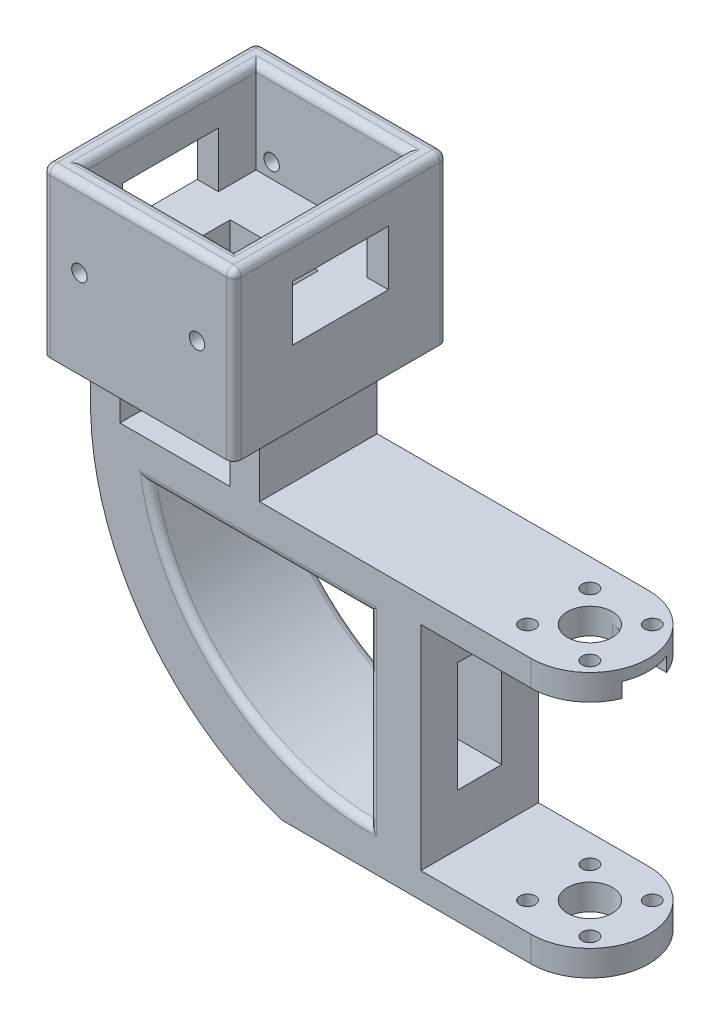
from build123d import *

# Parameters (mm, degrees)
SKETCH_1_R           = 3.05
SKETCH_1_R_2         = 1.05
EXTRUDE_1_DEPTH      = 3.5
SKETCH_2_W           = 16
SKETCH_2_H           = 36
EXTRUDE_2_DEPTH      = 3.5
SKETCH_4_W           = 16
SKETCH_4_H           = 36
EXTRUDE_3_DEPTH      = 41.43
CUT_EXTRUDE_1_DEPTH  = 2
SKETCH_6_W           = 23
SKETCH_6_H           = 16
EXTRUDE_4_DEPTH      = 19.21
EXTRUDE_7_DEPTH      = 12.5
EXTRUDE_7_DEPTH_BACK = 10
SKETCH_9_W           = 3.515
SKETCH_9_H           = 10
EXTRUDE_8_DEPTH      = 20
EXTRUDE_9_DEPTH      = 3
SKETCH_11_R          = 1.05
CUT_EXTRUDE_2_DEPTH  = 31.5
SKETCH_12_W          = 15
SKETCH_12_H          = 6.433017237
CUT_EXTRUDE_3_DEPTH  = 94.183551258
CUT_EXTRUDE_4_REACH  = 76.726
SKETCH_13_W          = 11.984921516
SKETCH_13_H          = 8
SKETCH_14_W          = 13.03
SKETCH_14_H          = 7.5
CUT_EXTRUDE_5_DEPTH  = 98.004196945
CUT_EXTRUDE_6_REACH  = 84.547
SKETCH_15_W          = 6
SKETCH_15_H          = 15
SKETCH_17_W          = 20
SKETCH_17_H          = 12.5
CUT_EXTRUDE_11_DEPTH = 11.625
CUT_EXTRUDE_12_DEPTH = 10.125
FILLET_2_R           = 1
FILLET_3_R           = 1
FILLET_5_R           = 1
FILLET_7_R           = 1


with BuildPart() as part:
    # 草图1 → 凸台-拉伸1 (new body)
    with BuildSketch(Plane(origin=(0, 0, 0), x_dir=(1, 0, 0), z_dir=(0, 1, 0))):
        with BuildLine():
            Line((0, 8), (-15, 8))
            Line((-15, 8), (-15, -8))
            Line((-15, -8), (0, -8))
            ThreePointArc((0, -8), (8, 0), (0, 8))
        make_face()
        with Locations(Location((0, 0, 0), (0, 0, 270))):
            Circle(SKETCH_1_R, mode=Mode.SUBTRACT)
        with Locations(Location((-4.242640687, 4.242640687, 0), (0, 0, 270))):
            Circle(SKETCH_1_R_2, mode=Mode.SUBTRACT)
        with Locations(Location((-4.242640687, -4.242640687, 0), (0, 0, 270))):
            Circle(SKETCH_1_R_2, mode=Mode.SUBTRACT)
        with Locations(Location((4.242640687, -4.242640687, 0), (0, 0, 90))):
            Circle(SKETCH_1_R_2, mode=Mode.SUBTRACT)
        with Locations(Location((4.242640687, 4.242640687, 0), (0, 0, 90))):
            Circle(SKETCH_1_R_2, mode=Mode.SUBTRACT)
    extrude(amount=EXTRUDE_1_DEPTH)


with BuildPart() as body_2:
    # 镜向4: mirrored copy
    add(part.part.mirror(Plane.ZX.offset(18)))


with BuildPart() as part_1:
    add(part.part)

    add(body_2.part)  # 凸台-拉伸2 merges body 2
    # 草图2 → 凸台-拉伸2 (add)
    with BuildSketch(Plane.ZY.offset(15)):
        with Locations((0, 18)):
            Rectangle(SKETCH_2_W, SKETCH_2_H)
    extrude(amount=EXTRUDE_2_DEPTH)

    # 草图4 → 凸台-拉伸3 (add)
    with BuildSketch(Plane.ZY.offset(18.5)):
        with Locations((0, 18)):
            Rectangle(SKETCH_4_W, SKETCH_4_H)
    extrude(amount=EXTRUDE_3_DEPTH)

    # 草图5 → 切除-拉伸1 (cut)
    with BuildSketch(Plane.XZ.offset(-32.5)):
        with BuildLine():
            Line((0, 3.05), (8.87097286, 3.05))
            Line((8.87097286, 3.05), (10.441846702, -3.05))
            Line((10.441846702, -3.05), (0, -3.05))
            ThreePointArc((0, -3.05), (3.05, 0), (0, 3.05))
        make_face()
    extrude(amount=-CUT_EXTRUDE_1_DEPTH, mode=Mode.SUBTRACT)

    # 草图6 → 凸台-拉伸4 (add)
    with BuildSketch(Plane(origin=(0, 36, 0), x_dir=(1, 0, 0), z_dir=(0, 1, 0))):
        with Locations((-48.43, 0)):
            Rectangle(SKETCH_6_W, SKETCH_6_H)
    extrude(amount=EXTRUDE_4_DEPTH)

    # 草图8 → 凸台-拉伸7 (add, two sides: drawn at the far end of the back side and taken through both)
    with BuildSketch(Plane(origin=(0, 55.21, 0), x_dir=(1, 0, 0), z_dir=(0, 1, 0)).offset(-EXTRUDE_7_DEPTH_BACK)):
        Polygon((-56.93, 11.515), (-36.93, 11.515), (-36.93, 14.515), (-59.93, 14.515), (-59.93, 11.515), (-59.93, 0), (-59.93, -11.515), (-59.93, -14.515), (-36.93, -14.515), (-36.93, -11.515), (-56.93, -11.515), (-56.93, -8), (-56.93, 8), align=None)
    extrude(amount=EXTRUDE_7_DEPTH + EXTRUDE_7_DEPTH_BACK)

    # 草图9 → 凸台-拉伸8 (add)
    with BuildSketch(Plane(origin=(-56.93, 0, 0), x_dir=(0, 0, -1), z_dir=(1, 0, 0))):
        with Locations((-9.7575, 50.21)):
            Rectangle(SKETCH_9_W, SKETCH_9_H)
        with Locations((9.7575, 50.21)):
            Rectangle(SKETCH_9_W, SKETCH_9_H)
    extrude(amount=EXTRUDE_8_DEPTH)

    # 草图10 → 凸台-拉伸9 (add)
    with BuildSketch(Plane(origin=(-36.93, 0, 0), x_dir=(0, 0, -1), z_dir=(1, 0, 0))):
        Polygon((-11.515, 67.71), (11.515, 67.71), (14.515, 67.71), (14.515, 45.21), (8, 45.21), (-8, 45.21), (-14.515, 45.21), (-14.515, 67.71), align=None)
    extrude(amount=EXTRUDE_9_DEPTH)

    # 草图11 → 切除-拉伸2 (cut, symmetric)
    with BuildSketch(Plane(origin=(0, 0, 11.515), x_dir=(-1, 0, 0), z_dir=(0, 0, -1))):
        with Locations((38.93, 57.21)):
            Circle(SKETCH_11_R)
        with Locations((54.93, 57.21)):
            Circle(SKETCH_11_R)
    extrude(amount=CUT_EXTRUDE_2_DEPTH, both=True, mode=Mode.SUBTRACT)

    # 草图12 → 切除-拉伸3 (cut, through all)
    with BuildSketch(Plane(origin=(0, 0, -8), x_dir=(-1, 0, 0), z_dir=(0, 0, -1))):
        with BuildLine():
            Line((22, 30.5), (22, 5.5))
            ThreePointArc((22, 5.5), (41.52562419, 12.569250972), (52, 30.5))
            Line((52, 30.5), (22, 30.5))
        make_face()
        with Locations((48.43, 38.993491382)):
            Rectangle(SKETCH_12_W, SKETCH_12_H)
        with BuildLine():
            Line((59.918359247, 35.060355361), (67.982296312, -21.171088437))
            Line((67.982296312, -21.171088437), (30.309681235, -1.008567897))
            ThreePointArc((30.309681235, -1.008567897), (51.317225959, 11.93373394), (59.918359247, 35.060355361))
        make_face()
    extrude(amount=-CUT_EXTRUDE_3_DEPTH, mode=Mode.SUBTRACT)

    # 草图13 → 切除-拉伸4 (cut, up to next)
    with BuildSketch(Plane.XZ.offset(-42.21), mode=Mode.PRIVATE) as cut_extrude_4_sk1:
        with Locations((-46.937539242, 0)):
            Rectangle(SKETCH_13_W, SKETCH_13_H)
    cut_extrude_4_tool1 = extrude(cut_extrude_4_sk1.sketch, amount=-CUT_EXTRUDE_4_REACH, mode=Mode.PRIVATE) & part_1.part
    add(cut_extrude_4_tool1.solids().sort_by_distance((-46.937539, 42.21, 0))[0], mode=Mode.SUBTRACT)

    # 草图14 → 切除-拉伸5 (cut, through all)
    with BuildSketch(Plane.ZY.offset(59.93)):
        with Locations((0, 58.96)):
            Rectangle(SKETCH_14_W, SKETCH_14_H)
    extrude(amount=-CUT_EXTRUDE_5_DEPTH, mode=Mode.SUBTRACT)

    # 草图15 → 切除-拉伸6 (cut, up to next)
    with BuildSketch(Plane(origin=(-15, 0, 0), x_dir=(0, 0, -1), z_dir=(1, 0, 0)), mode=Mode.PRIVATE) as cut_extrude_6_sk1:
        with Locations((0, 18)):
            Rectangle(SKETCH_15_W, SKETCH_15_H)
    cut_extrude_6_tool1 = extrude(cut_extrude_6_sk1.sketch, amount=-CUT_EXTRUDE_6_REACH, mode=Mode.PRIVATE) & part_1.part
    add(cut_extrude_6_tool1.solids().sort_by_distance((-15, 18, 0))[0], mode=Mode.SUBTRACT)

    # 草图17 → 切除-拉伸11 (cut, symmetric)
    with BuildSketch(Plane(origin=(0, 0, 0), x_dir=(-1, 0, 0), z_dir=(0, 0, -1))):
        with Locations((46.93, 61.46)):
            Rectangle(SKETCH_17_W, SKETCH_17_H)
    extrude(amount=CUT_EXTRUDE_11_DEPTH, both=True, mode=Mode.SUBTRACT)

    # 草图18 → 切除-拉伸12 (cut, symmetric)
    with BuildSketch(Plane.ZY.offset(46.93)):
        Polygon((-11.625, 55.21), (-6.515, 55.21), (-6.515, 62.71), (6.515, 62.71), (6.515, 55.21), (11.625, 55.21), (11.625, 67.71), (-11.625, 67.71), align=None)
    extrude(amount=CUT_EXTRUDE_12_DEPTH, both=True, mode=Mode.SUBTRACT)

    # 圆角2
    fillet_2_edges = [part_1.edges().sort_by_distance(p)[0] for p in [
        (-46.93, 67.71, -11.625),
        (-46.93, 67.71, 11.625),
        (-36.805, 67.71, 0),
        (-57.055, 67.71, 0),
    ]]
    fillet(fillet_2_edges, radius=FILLET_2_R)

    # 圆角3
    fillet_3_edges = [part_1.edges().sort_by_distance(p)[0] for p in [
        (-46.93, 67.71, -14.515),
        (-59.93, 67.71, 0),
        (-46.93, 67.71, 14.515),
        (-33.93, 67.71, 0),
    ]]
    fillet(fillet_3_edges, radius=FILLET_3_R)

    # 圆角5
    # the kernel refuses this fillet: 1 mm, written as the material it takes off along each edge
    with BuildSketch(Plane(origin=(-58.93, 66.71, -13.515), x_dir=(-1, 0, 0), z_dir=(0, 0, -1))) as fillet_5_piece_1_section:
        Polygon((0, 0), (FILLET_5_R, 0), (FILLET_5_R, FILLET_5_R), (0, FILLET_5_R), align=None)
    fillet_5_piece_1 = extrude(amount=FILLET_5_R, mode=Mode.PRIVATE)
    fillet_5_piece_1 = fillet_5_piece_1 - Plane(origin=(-58.93, 66.71, -13.515), x_dir=(0.7071067811865475, -0.7071067811865475, 0), z_dir=(0, 0, -1)) * Sphere(FILLET_5_R, mode=Mode.PRIVATE)
    add(fillet_5_piece_1, mode=Mode.SUBTRACT)
    with BuildSketch(Plane(origin=(-34.93, 66.71, -13.515), x_dir=(1, 0, 0), z_dir=(0, 0, -1))) as fillet_5_piece_2_section:
        Polygon((0, 0), (FILLET_5_R, 0), (FILLET_5_R, -FILLET_5_R), (0, -FILLET_5_R), align=None)
    fillet_5_piece_2 = extrude(amount=FILLET_5_R, mode=Mode.PRIVATE)
    fillet_5_piece_2 = fillet_5_piece_2 - Plane(origin=(-34.93, 66.71, -13.515), x_dir=(-0.7071067811865475, -0.7071067811865475, 0), z_dir=(0, 0, -1)) * Sphere(FILLET_5_R, mode=Mode.PRIVATE)
    add(fillet_5_piece_2, mode=Mode.SUBTRACT)
    with BuildSketch(Plane(origin=(-58.93, 66.71, 13.515), x_dir=(0, 0, 1), z_dir=(-1, 0, 0))) as fillet_5_piece_3_section:
        Polygon((0, 0), (FILLET_5_R, 0), (FILLET_5_R, FILLET_5_R), (0, FILLET_5_R), align=None)
    fillet_5_piece_3 = extrude(amount=FILLET_5_R, mode=Mode.PRIVATE)
    fillet_5_piece_3 = fillet_5_piece_3 - Plane(origin=(-58.93, 66.71, 13.515), x_dir=(0, -0.7071067811865475, -0.7071067811865475), z_dir=(-1, 0, 0)) * Sphere(FILLET_5_R, mode=Mode.PRIVATE)
    add(fillet_5_piece_3, mode=Mode.SUBTRACT)
    with BuildSketch(Plane(origin=(-34.93, 66.71, 13.515), x_dir=(0, 0, 1), z_dir=(1, 0, 0))) as fillet_5_piece_4_section:
        Polygon((0, 0), (FILLET_5_R, 0), (FILLET_5_R, -FILLET_5_R), (0, -FILLET_5_R), align=None)
    fillet_5_piece_4 = extrude(amount=FILLET_5_R, mode=Mode.PRIVATE)
    fillet_5_piece_4 = fillet_5_piece_4 - Plane(origin=(-34.93, 66.71, 13.515), x_dir=(0, -0.7071067811865475, -0.7071067811865475), z_dir=(1, 0, 0)) * Sphere(FILLET_5_R, mode=Mode.PRIVATE)
    add(fillet_5_piece_4, mode=Mode.SUBTRACT)
    with BuildSketch(Plane(origin=(-59.93, 42.71, 14.515), x_dir=(0, 0, -1), z_dir=(0, 1, 0)), Plane(origin=(-59.93, 42.71, -14.515), x_dir=(1, 0, 0), z_dir=(0, 1, 0)), Plane(origin=(-33.93, 66.71, -14.515), x_dir=(-1, 0, 0), z_dir=(0, -1, 0))) as fillet_5_piece_5:
        with BuildLine():
            CenterArc((FILLET_5_R, -FILLET_5_R), FILLET_5_R, 90, 90)
            Line((0, -FILLET_5_R), (0, 0))
            Line((0, 0), (FILLET_5_R, 0))
        make_face()
    extrude(amount=24, mode=Mode.SUBTRACT)
    with BuildSketch(Plane(origin=(-33.93, 42.71, 14.515), x_dir=(0, 0, -1), z_dir=(0, 1, 0))) as fillet_5_piece_6:
        with BuildLine():
            CenterArc((FILLET_5_R, FILLET_5_R), FILLET_5_R, 180, 90)
            Line((0, FILLET_5_R), (0, 0))
            Line((0, 0), (FILLET_5_R, 0))
        make_face()
    extrude(amount=24, mode=Mode.SUBTRACT)

    # 圆角7
    fillet_7_edges = [part_1.edges().sort_by_distance(p)[0] for p in [
        (-22, 18, 8),
        (-41.52562419, 12.569250972, 8),
        (-37, 30.5, 8),
        (-37, 30.5, -8),
        (-22, 18, -8),
        (-41.52562419, 12.569250972, -8),
    ]]
    fillet(fillet_7_edges, radius=FILLET_7_R)


solid = part_1.part
